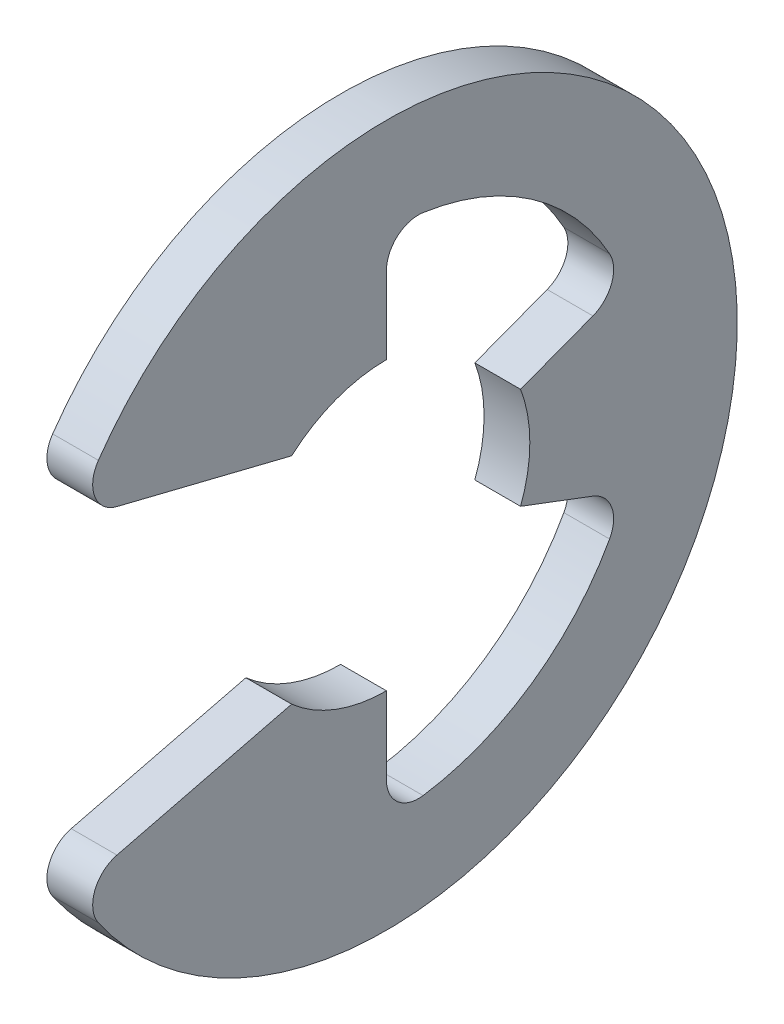
from build123d import *

# Parameters (mm, degrees)
EXTRUDE1_DEPTH = 0.1905
FILLET1_R      = 0.2667


with BuildPart() as part:
    # Sketch1 → Extrude1 (new, symmetric)
    with BuildSketch(Plane(origin=(0, 0, 0), x_dir=(0, 0, -1), z_dir=(1, 0, 0))):
        with BuildLine():
            Line((-2.593812453, -1.343271365), (-0.789624479, -0.89535))
            ThreePointArc((-0.789624479, -0.89535), (-0.422072038, -1.116697647), (0, -1.1938))
            Line((0, -1.1938), (0, -2.123767742))
            ThreePointArc((0, -2.123767742), (1.207419966, -1.74714809), (1.986602815, -0.750865286))
            Line((1.986602815, -0.750865286), (1.116697647, -0.422072038))
            ThreePointArc((1.116697647, -0.422072038), (1.1938, 0), (1.116697647, 0.422072038))
            Line((1.116697647, 0.422072038), (1.986602815, 0.750865286))
            ThreePointArc((1.986602815, 0.750865286), (1.207419966, 1.74714809), (0, 2.123767742))
            Line((0, 2.123767742), (0, 1.1938))
            ThreePointArc((0, 1.1938), (-0.422072038, 1.116697647), (-0.789624479, 0.89535))
            Line((-0.789624479, 0.89535), (-2.593812453, 1.343271365))
            ThreePointArc((-2.593812453, 1.343271365), (2.921, 0), (-2.593812453, -1.343271365))
        make_face()
    extrude(amount=EXTRUDE1_DEPTH, both=True)

    # Fillet1
    fillet1_edges = [part.edges().sort_by_distance(p)[0] for p in [
        (0, -2.123767742, 0),
        (0, 2.123767742, 0),
        (0, -1.343271365, 2.593812453),
        (0, 1.343271365, 2.593812453),
        (0, -0.750865286, -1.986602815),
        (0, 0.750865286, -1.986602815),
    ]]
    fillet(fillet1_edges, radius=FILLET1_R)


solid = part.part
